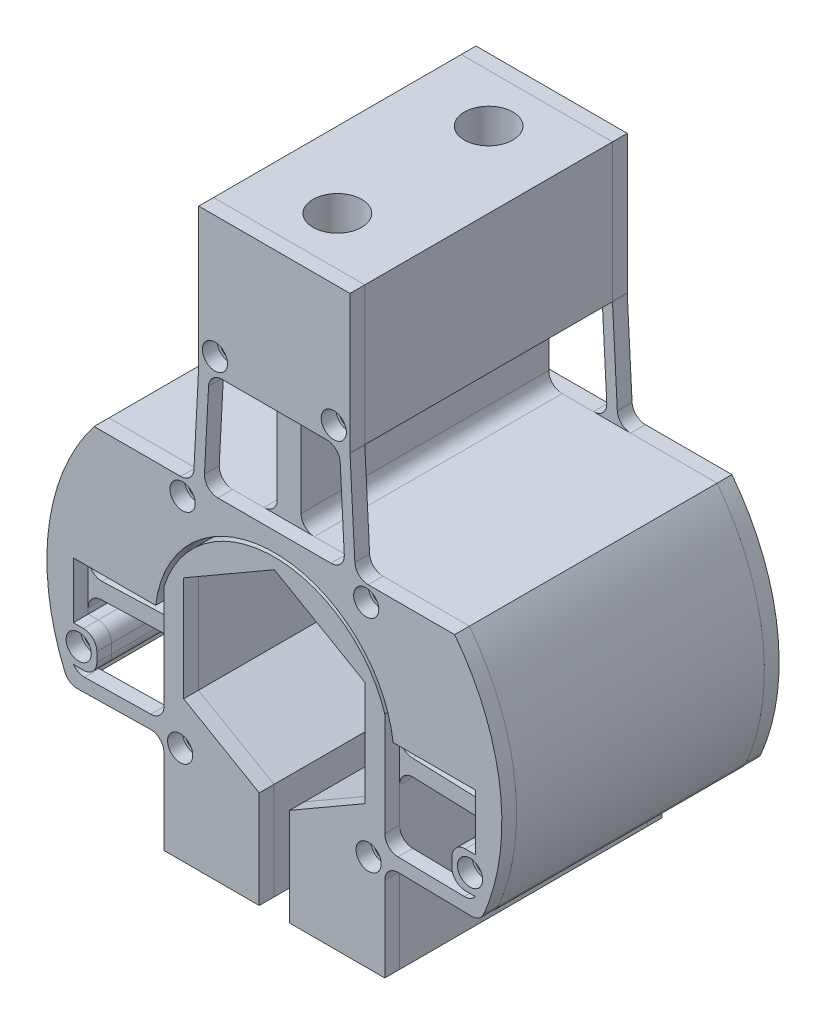
from build123d import *

# Parameters (mm, degrees)
MONKEY_CENTER_W                      = 15.875
MONKEY_CENTER_H                      = 14.525921271
MONKEY_CENTER_W_2                    = 2.5
MONKEY_CENTER_H_2                    = 11
MONKEY_CENTER_W_3                    = 3.8
MONKEY_CENTER_H_3                    = 3.8
CENTRAL_MONKEY_DEPTH                 = 13
CENTRAL_MONKEY_FILLETS_R             = 1.4
MONKEY_FRONT_W                       = 15.875
MONKEY_FRONT_H                       = 14.525921271
MONKEY_FRONT_W_2                     = 3.8
MONKEY_FRONT_H_2                     = 3.8
FRONT_MONKEY_DEPTH                   = 1.55
FRONT_MONKEY_FILLETS_START           = 12
FRONT_MONKEY_FILLETS_DEPTH           = 4
FRONT_MONKEY_FILLETS_START_2         = 13
FRONT_MONKEY_FILLETS_2_DEPTH         = 1.55
TAP_DRILL_FOR_3_48_TAP1_AT_2_COUNT   = 2
TAP_DRILL_FOR_3_48_TAP1_AT_2_PITCH   = 14.795945391
TAP_DRILL_FOR_3_48_TAP1_AT_3_COUNT   = 2
TAP_DRILL_FOR_3_48_TAP1_AT_3_PITCH   = 21.43304983
TAP_DRILL_FOR_3_48_TAP1_AT_4_COUNT   = 2
TAP_DRILL_FOR_3_48_TAP1_AT_4_PITCH   = 19.275
TAP_DRILL_FOR_3_48_TAP1_AT_5_COUNT   = 2
TAP_DRILL_FOR_3_48_TAP1_AT_5_PITCH   = 30.183532001
TAP_DRILL_FOR_3_48_TAP1_AT_6_COUNT   = 2
TAP_DRILL_FOR_3_48_TAP1_AT_6_PITCH   = 23.019176333
TAP_DRILL_FOR_3_48_TAP1_AT_7_COUNT   = 2
TAP_DRILL_FOR_3_48_TAP1_AT_7_PITCH   = 22.007241115
TAP_DRILL_FOR_3_48_TAP1_AT_8_COUNT   = 2
TAP_DRILL_FOR_3_48_TAP1_AT_8_PITCH   = 35.722129408
SKETCH33_W                           = 1.3208
SKETCH33_H                           = 29.1
F_3_CLEARANCE_HOLE1_AT_2_COUNT       = 2
F_3_CLEARANCE_HOLE1_AT_2_PITCH       = 12.475
F_3_CLEARANCE_HOLE1_AT_3_COUNT       = 2
F_3_CLEARANCE_HOLE1_AT_3_PITCH       = 14.795945391
F_3_CLEARANCE_HOLE1_AT_4_COUNT       = 2
F_3_CLEARANCE_HOLE1_AT_4_PITCH       = 21.43304983
F_3_CLEARANCE_HOLE1_AT_5_COUNT       = 2
F_3_CLEARANCE_HOLE1_AT_5_PITCH       = 36.441149158
F_3_CLEARANCE_HOLE1_AT_6_COUNT       = 2
F_3_CLEARANCE_HOLE1_AT_6_PITCH       = 37.595420711
F_3_CLEARANCE_HOLE1_AT_7_COUNT       = 2
F_3_CLEARANCE_HOLE1_AT_7_PITCH       = 40.744432545
F_3_CLEARANCE_HOLE1_AT_8_COUNT       = 2
F_3_CLEARANCE_HOLE1_AT_8_PITCH       = 42.899745894
BOLTS_MIRROR_START                   = -16
BOLTS_MIRROR_OUTLINE_R               = 1.3208
BOLTS_MIRROR_DEPTH                   = 4
SKETCH16_W                           = 1.35255
SKETCH16_H                           = 10
TAP_DRILL_FOR_1_4_20_TAP1_AT_2_COUNT = 2
TAP_DRILL_FOR_1_4_20_TAP1_AT_2_PITCH = 15.875


with BuildPart() as part:
    # monkey-center → central-monkey (new, symmetric)
    with BuildSketch(Plane.XY):
        with Locations((0, 32.820779365)):
            Rectangle(MONKEY_CENTER_W, MONKEY_CENTER_H)
        with Locations((0, 20.057818729)):
            Rectangle(MONKEY_CENTER_W_2, MONKEY_CENTER_H_2)
        with BuildLine():
            Line((21.606429043, -10.16), (21.0875, -10.16))
            Line((21.0875, -10.16), (21.0875, 1.524))
            Line((21.0875, 1.524), (12.46500041, 1.524))
            ThreePointArc((12.46500041, 1.524), (0, 12.557818729), (-12.46500041, 1.524))
            Line((-12.46500041, 1.524), (-21.0875, 1.524))
            Line((-21.0875, 1.524), (-21.0875, -10.16))
            Line((-21.0875, -10.16), (-21.606429043, -10.16))
            ThreePointArc((-21.606429043, -10.16), (-23.736677672, 2.575559953), (-18.924409894, 14.557818729))
            Line((-18.924409894, 14.557818729), (18.924409894, 14.557818729))
            ThreePointArc((18.924409894, 14.557818729), (23.736677672, 2.575559953), (21.606429043, -10.16))
        make_face()
        with BuildLine():
            Line((-1.5875, -10.081979076), (-9.525, -5.499261314))
            Line((-9.525, -5.499261314), (-9.525, 5.499261314))
            Line((-9.525, 5.499261314), (0, 10.998522628))
            Line((0, 10.998522628), (9.525, 5.499261314))
            Line((9.525, 5.499261314), (9.525, -5.499261314))
            Line((9.525, -5.499261314), (1.5875, -10.081979076))
            Line((1.5875, -10.081979076), (1.5875, -20.32))
            Line((1.5875, -20.32), (11.5875, -20.32))
            Line((11.5875, -20.32), (11.5875, -2.077036225))
            Line((11.5875, -2.077036225), (11.5875, -0.376))
            Line((11.5875, -0.376), (11.5875, 3.68))
            ThreePointArc((11.5875, 3.68), (0, 12.157818729), (-11.5875, 3.68))
            Line((-11.5875, 3.68), (-11.5875, -0.376))
            Line((-11.5875, -0.376), (-11.5875, -2.077036225))
            Line((-11.5875, -2.077036225), (-11.5875, -20.32))
            Line((-11.5875, -20.32), (-1.5875, -20.32))
            Line((-1.5875, -20.32), (-1.5875, -10.081979076))
        make_face()
        Polygon((-21.0875, -2.408783535), (-11.5875, -2.077036225), (-11.5875, -0.376), (-21.0875, -0.70774731), align=None)
        Polygon((11.5875, -0.376), (11.5875, -2.077036225), (21.0875, -2.408783535), (21.0875, -0.70774731), align=None)
        with Locations((-20.538310453, -6.26)):
            Rectangle(MONKEY_CENTER_W_3, MONKEY_CENTER_H_3)
        with Locations((20.538310453, -6.26)):
            Rectangle(MONKEY_CENTER_W_3, MONKEY_CENTER_H_3)
    extrude(amount=CENTRAL_MONKEY_DEPTH, both=True)

    # central-monkey-fillets
    # the kernel refuses this fillet: 1.4 mm, written as the material it adds along each edge
    with BuildSketch(Plane(origin=(11.5875, -0.376, -13), x_dir=(0.9993908270190959, -0.034899496702497444, 0), z_dir=(0, 0, 1)), Plane(origin=(-21.0875, -2.408783535, -13), x_dir=(0, -1, 0), z_dir=(0, 0, 1))) as central_monkey_fillets_piece_1:
        with BuildLine():
            CenterArc((CENTRAL_MONKEY_FILLETS_R * 0.965688774807, CENTRAL_MONKEY_FILLETS_R), CENTRAL_MONKEY_FILLETS_R, 182, 88)
            Line((-CENTRAL_MONKEY_FILLETS_R * 0.033702052212, CENTRAL_MONKEY_FILLETS_R * 0.965100503298), (0, 0))
            Line((0, 0), (CENTRAL_MONKEY_FILLETS_R * 0.965688774807, 0))
        make_face()
    extrude(amount=26)
    with BuildSketch(Plane(origin=(21.0875, -0.70774731, -13), x_dir=(0, 1, 0), z_dir=(0, 0, 1)), Plane(origin=(-21.0875, -0.70774731, -13), x_dir=(0.9993908270190959, 0.03489949670249768, 0), z_dir=(0, 0, 1))) as central_monkey_fillets_piece_2:
        with BuildLine():
            CenterArc((CENTRAL_MONKEY_FILLETS_R * 1.03553031379, CENTRAL_MONKEY_FILLETS_R), CENTRAL_MONKEY_FILLETS_R, 178, 92)
            Line((CENTRAL_MONKEY_FILLETS_R * 0.0361394867715, CENTRAL_MONKEY_FILLETS_R * 1.0348994967), (0, 0))
            Line((0, 0), (CENTRAL_MONKEY_FILLETS_R * 1.03553031379, 0))
        make_face()
    extrude(amount=26)
    with BuildSketch(Plane(origin=(-11.5875, -0.376, 13), x_dir=(0, 1, 0), z_dir=(0, 0, -1)), Plane(origin=(21.0875, -2.408783535, 13), x_dir=(-0.9993908270190959, 0.0348994967024972, 0), z_dir=(0, 0, -1))) as central_monkey_fillets_piece_3:
        with BuildLine():
            CenterArc((CENTRAL_MONKEY_FILLETS_R * 0.965688774807, -CENTRAL_MONKEY_FILLETS_R), CENTRAL_MONKEY_FILLETS_R, 90, 88)
            Line((-CENTRAL_MONKEY_FILLETS_R * 0.033702052212, -CENTRAL_MONKEY_FILLETS_R * 0.965100503298), (0, 0))
            Line((0, 0), (CENTRAL_MONKEY_FILLETS_R * 0.965688774807, 0))
        make_face()
    extrude(amount=26)
    with BuildSketch(Plane(origin=(-1.25, 14.557818729, 13), x_dir=(0, 1, 0), z_dir=(0, 0, -1)), Plane(origin=(1.25, 14.557818729, 13), x_dir=(1, 0, 0), z_dir=(0, 0, -1))) as central_monkey_fillets_piece_4:
        with BuildLine():
            CenterArc((CENTRAL_MONKEY_FILLETS_R, -CENTRAL_MONKEY_FILLETS_R), CENTRAL_MONKEY_FILLETS_R, 90, 90)
            Line((0, -CENTRAL_MONKEY_FILLETS_R), (0, 0))
            Line((0, 0), (CENTRAL_MONKEY_FILLETS_R, 0))
        make_face()
    extrude(amount=26)
    with BuildSketch(Plane(origin=(-1.25, 25.557818729, -13), x_dir=(-1, 0, 0), z_dir=(0, 0, 1)), Plane(origin=(1.25, 25.557818729, -13), x_dir=(0, -1, 0), z_dir=(0, 0, 1))) as central_monkey_fillets_piece_5:
        with BuildLine():
            CenterArc((CENTRAL_MONKEY_FILLETS_R, CENTRAL_MONKEY_FILLETS_R), CENTRAL_MONKEY_FILLETS_R, 180, 90)
            Line((0, CENTRAL_MONKEY_FILLETS_R), (0, 0))
            Line((0, 0), (CENTRAL_MONKEY_FILLETS_R, 0))
        make_face()
    extrude(amount=26)
    with BuildSketch(Plane(origin=(11.5875, -2.077036225, 13), x_dir=(0, -1, 0), z_dir=(0, 0, -1)), Plane(origin=(-11.5875, -2.077036225, 13), x_dir=(-0.9993908270190959, -0.03489949670249768, 0), z_dir=(0, 0, -1))) as central_monkey_fillets_piece_6:
        with BuildLine():
            CenterArc((CENTRAL_MONKEY_FILLETS_R * 1.03553031379, -CENTRAL_MONKEY_FILLETS_R), CENTRAL_MONKEY_FILLETS_R, 90, 92)
            Line((CENTRAL_MONKEY_FILLETS_R * 0.0361394867715, -CENTRAL_MONKEY_FILLETS_R * 1.0348994967), (0, 0))
            Line((0, 0), (CENTRAL_MONKEY_FILLETS_R * 1.03553031379, 0))
        make_face()
    extrude(amount=26)
    # the kernel refuses this fillet: 1.4 mm, written as the material it takes off along each edge
    with BuildSketch(Plane(origin=(-18.638310453, -8.16, 16.5), x_dir=(0, 1, 0), z_dir=(0, 0, -1)), Plane(origin=(18.638310453, -4.36, 16.5), x_dir=(0, -1, 0), z_dir=(0, 0, -1))) as central_monkey_fillets_2_piece_1:
        with BuildLine():
            CenterArc((CENTRAL_MONKEY_FILLETS_R, -CENTRAL_MONKEY_FILLETS_R), CENTRAL_MONKEY_FILLETS_R, 90, 90)
            Line((0, -CENTRAL_MONKEY_FILLETS_R), (0, 0))
            Line((0, 0), (CENTRAL_MONKEY_FILLETS_R, 0))
        make_face()
    extrude(amount=33, mode=Mode.SUBTRACT)
    with BuildSketch(Plane(origin=(-18.638310453, -4.36, -16.5), x_dir=(-1, 0, 0), z_dir=(0, 0, 1)), Plane(origin=(18.638310453, -8.16, -16.5), x_dir=(1, 0, 0), z_dir=(0, 0, 1))) as central_monkey_fillets_2_piece_2:
        with BuildLine():
            CenterArc((CENTRAL_MONKEY_FILLETS_R, CENTRAL_MONKEY_FILLETS_R), CENTRAL_MONKEY_FILLETS_R, 180, 90)
            Line((0, CENTRAL_MONKEY_FILLETS_R), (0, 0))
            Line((0, 0), (CENTRAL_MONKEY_FILLETS_R, 0))
        make_face()
    extrude(amount=33, mode=Mode.SUBTRACT)
    with BuildSketch(Plane(origin=(-21.606429043, -10.16, 15.15694949), x_dir=(1, 0, 0), z_dir=(0, 0, -1)), Plane(origin=(21.606429043, -10.16, -15.15694949), x_dir=(-1, 0, 0), z_dir=(0, 0, 1))) as central_monkey_fillets_2_piece_3:
        with BuildLine():
            CenterArc((0.934644279, -1.336854832), CENTRAL_MONKEY_FILLETS_R, 107.273872023, 49.612336383)
            ThreePointArc((-0.352973566, -0.787272912), (-0.180043171, -0.392041951), (0, 0))
            Line((0, 0), (0.518929043, 0))
        make_face()
    extrude(amount=30.313898981, mode=Mode.SUBTRACT)


with BuildPart() as body_2:
    # monkey-front → front-monkey (new body)
    with BuildSketch(Plane.XY.offset(13)):
        with Locations((0, 32.820779365)):
            Rectangle(MONKEY_FRONT_W, MONKEY_FRONT_H)
        Polygon((-7.9375, 25.557818729), (-8.513985572, 14.557818729), (-7.413985572, 14.557818729), (-6.8375, 25.557818729), align=None)
        Polygon((7.413985572, 14.557818729), (8.513985572, 14.557818729), (7.9375, 25.557818729), (6.8375, 25.557818729), align=None)
        with BuildLine():
            Line((21.606429043, -10.16), (21.0875, -10.16))
            Line((21.0875, -10.16), (21.0875, 1.524))
            Line((21.0875, 1.524), (12.46500041, 1.524))
            ThreePointArc((12.46500041, 1.524), (0, 12.557818729), (-12.46500041, 1.524))
            Line((-12.46500041, 1.524), (-21.0875, 1.524))
            Line((-21.0875, 1.524), (-21.0875, -10.16))
            Line((-21.0875, -10.16), (-21.606429043, -10.16))
            ThreePointArc((-21.606429043, -10.16), (-23.736677672, 2.575559953), (-18.924409894, 14.557818729))
            Line((-18.924409894, 14.557818729), (18.924409894, 14.557818729))
            ThreePointArc((18.924409894, 14.557818729), (23.736677672, 2.575559953), (21.606429043, -10.16))
        make_face()
        with BuildLine():
            Line((-1.5875, -10.081979076), (-9.525, -5.499261314))
            Line((-9.525, -5.499261314), (-9.525, 5.499261314))
            Line((-9.525, 5.499261314), (0, 10.998522628))
            Line((0, 10.998522628), (9.525, 5.499261314))
            Line((9.525, 5.499261314), (9.525, -5.499261314))
            Line((9.525, -5.499261314), (1.5875, -10.081979076))
            Line((1.5875, -10.081979076), (1.5875, -20.32))
            Line((1.5875, -20.32), (11.5875, -20.32))
            Line((11.5875, -20.32), (11.5875, -9.994176883))
            Line((11.5875, -9.994176883), (11.5875, -8.594176883))
            Line((11.5875, -8.594176883), (11.5875, 3.68))
            ThreePointArc((11.5875, 3.68), (0, 12.157818729), (-11.5875, 3.68))
            Line((-11.5875, 3.68), (-11.5875, -8.594176883))
            Line((-11.5875, -8.594176883), (-11.5875, -9.994176883))
            Line((-11.5875, -9.994176883), (-11.5875, -20.32))
            Line((-11.5875, -20.32), (-1.5875, -20.32))
            Line((-1.5875, -20.32), (-1.5875, -10.081979076))
        make_face()
        Polygon((-21.0875, -10.16), (-11.5875, -9.994176883), (-11.5875, -8.594176883), (-21.0875, -8.76), align=None)
        Polygon((11.5875, -8.594176883), (11.5875, -9.994176883), (21.0875, -10.16), (21.0875, -8.76), align=None)
        with Locations((-20.538310453, -6.26)):
            Rectangle(MONKEY_FRONT_W_2, MONKEY_FRONT_H_2)
        with Locations((20.538310453, -6.26)):
            Rectangle(MONKEY_FRONT_W_2, MONKEY_FRONT_H_2)
    extrude(amount=FRONT_MONKEY_DEPTH)

    # front-monkey-fillets: read off the stored shape, not the designer's step
    # front-monkey-fillets outline → front-monkey-fillets (cut)
    with BuildSketch(Plane.XY.offset(FRONT_MONKEY_FILLETS_START)):
        with BuildLine():
            Line((18.638310453, -4.36), (18.638310453, -5.76))
            ThreePointArc((18.638310453, -5.76), (19.04836096, -4.770050506), (20.038310453, -4.36))
            Line((20.038310453, -4.36), (18.638310453, -4.36))
        make_face()
        with BuildLine():
            ThreePointArc((20.038310453, -8.16), (19.04836096, -7.749949494), (18.638310453, -6.76))
            Line((18.638310453, -6.76), (18.638310453, -8.16))
            Line((18.638310453, -8.16), (20.038310453, -8.16))
        make_face()
        with BuildLine():
            Line((-18.638310453, -4.36), (-20.038310453, -4.36))
            ThreePointArc((-20.038310453, -4.36), (-19.04836096, -4.770050506), (-18.638310453, -5.76))
            Line((-18.638310453, -5.76), (-18.638310453, -4.36))
        make_face()
        with BuildLine():
            Line((-18.638310453, -8.16), (-18.638310453, -6.76))
            ThreePointArc((-18.638310453, -6.76), (-19.04836096, -7.749949493), (-20.038310453, -8.16))
            Line((-20.038310453, -8.16), (-18.638310453, -8.16))
        make_face()
        with BuildLine():
            ThreePointArc((21.606429043, -10.16), (21.802989861, -9.731033302), (21.991035125, -9.298265973))
            ThreePointArc((21.991035125, -9.298265973), (21.464880219, -9.926654032), (20.677129099, -10.152836949))
            Line((20.677129099, -10.152836949), (21.0875, -10.16))
            Line((21.0875, -10.16), (21.606429043, -10.16))
        make_face()
        with BuildLine():
            ThreePointArc((-20.677129099, -10.152836949), (-21.464880219, -9.926654032), (-21.991035126, -9.298265973))
            ThreePointArc((-21.991035126, -9.298265973), (-21.802989861, -9.731033302), (-21.606429043, -10.16))
            Line((-21.606429043, -10.16), (-21.0875, -10.16))
            Line((-21.0875, -10.16), (-20.677129099, -10.152836949))
        make_face()
    extrude(amount=FRONT_MONKEY_FILLETS_DEPTH, mode=Mode.SUBTRACT)

    # front-monkey-fillets 2 outline → front-monkey-fillets 2 (add)
    with BuildSketch(Plane.XY.offset(FRONT_MONKEY_FILLETS_START_2)):
        with BuildLine():
            Line((11.5875, -8.594176883), (12.963066631, -8.618187488))
            ThreePointArc((12.963066631, -8.618187488), (11.988949371, -8.199673685), (11.5875, -7.218400715))
            Line((11.5875, -7.218400715), (11.5875, -8.594176883))
        make_face()
        with BuildLine():
            Line((21.0875, -8.76), (21.0875, -8.16))
            ThreePointArc((21.0875, -8.16), (20.579057304, -8.592094016), (19.928356233, -8.73976707))
            Line((19.928356233, -8.73976707), (21.0875, -8.76))
        make_face()
        with BuildLine():
            ThreePointArc((-11.5875, -7.218400715), (-11.988949371, -8.199673685), (-12.963066631, -8.618187488))
            Line((-12.963066631, -8.618187488), (-11.5875, -8.594176883))
            Line((-11.5875, -8.594176883), (-11.5875, -7.218400715))
        make_face()
        with BuildLine():
            ThreePointArc((-19.928356233, -8.73976707), (-20.579057304, -8.592094016), (-21.0875, -8.16))
            Line((-21.0875, -8.16), (-21.0875, -8.76))
            Line((-21.0875, -8.76), (-19.928356233, -8.73976707))
        make_face()
        with BuildLine():
            ThreePointArc((11.5875, -11.418827233), (12.00622703, -10.420276605), (13.011933369, -10.01904046))
            Line((13.011933369, -10.01904046), (11.5875, -9.994176883))
            Line((11.5875, -9.994176883), (11.5875, -11.418827233))
        make_face()
        with BuildLine():
            ThreePointArc((9.842535966, 14.557818729), (8.87883956, 14.94229461), (8.444454617, 15.88454839))
            Line((8.444454617, 15.88454839), (8.513985572, 14.557818729))
            Line((8.513985572, 14.557818729), (9.842535966, 14.557818729))
        make_face()
        with BuildLine():
            ThreePointArc((7.939418651, 25.521208681), (7.937979745, 25.557831292), (7.9375, 25.594479019))
            Line((7.9375, 25.594479019), (7.9375, 25.557818729))
            Line((7.9375, 25.557818729), (7.939418651, 25.521208681))
        make_face()
        with BuildLine():
            Line((-11.5875, -9.994176883), (-13.011933369, -10.01904046))
            ThreePointArc((-13.011933369, -10.01904046), (-12.00622703, -10.420276605), (-11.5875, -11.418827233))
            Line((-11.5875, -11.418827233), (-11.5875, -9.994176883))
        make_face()
        with BuildLine():
            Line((-8.513985572, 14.557818729), (-8.444454617, 15.88454839))
            ThreePointArc((-8.444454617, 15.88454839), (-8.87883956, 14.94229461), (-9.842535966, 14.557818729))
            Line((-9.842535966, 14.557818729), (-8.513985572, 14.557818729))
        make_face()
        with BuildLine():
            ThreePointArc((-7.9375, 25.594479019), (-7.937979745, 25.557831292), (-7.939418651, 25.521208681))
            Line((-7.939418651, 25.521208681), (-7.9375, 25.557818729))
            Line((-7.9375, 25.557818729), (-7.9375, 25.594479019))
        make_face()
        with BuildLine():
            ThreePointArc((-6.907030955, 24.231089068), (-6.472646013, 25.173342849), (-5.508949607, 25.557818729))
            Line((-5.508949607, 25.557818729), (-6.8375, 25.557818729))
            Line((-6.8375, 25.557818729), (-6.907030955, 24.231089068))
        make_face()
        with BuildLine():
            Line((6.8375, 25.557818729), (5.508949607, 25.557818729))
            ThreePointArc((5.508949607, 25.557818729), (6.472646013, 25.173342849), (6.907030955, 24.231089068))
            Line((6.907030955, 24.231089068), (6.8375, 25.557818729))
        make_face()
        with BuildLine():
            ThreePointArc((-5.938693397, 14.557818729), (-6.954217516, 14.994122323), (-7.336774745, 16.031089068))
            Line((-7.336774745, 16.031089068), (-7.413985572, 14.557818729))
            Line((-7.413985572, 14.557818729), (-5.938693397, 14.557818729))
        make_face()
        with BuildLine():
            Line((7.413985572, 14.557818729), (7.336774745, 16.031089068))
            ThreePointArc((7.336774745, 16.031089068), (6.954217516, 14.994122323), (5.938693397, 14.557818729))
            Line((5.938693397, 14.557818729), (7.413985572, 14.557818729))
        make_face()
    extrude(amount=FRONT_MONKEY_FILLETS_2_DEPTH)


with BuildPart() as body_3:
    # back-monkey: mirrored copy
    add(body_2.part.mirror(Plane.XY))

    # bolts-mirror: read off the stored shape, not the designer's step
    # bolts-mirror outline → bolts-mirror (cut)
    with BuildSketch(Plane.XY.offset(BOLTS_MIRROR_START)):
        with Locations((-6.2375, 27.257818729)):
            Circle(BOLTS_MIRROR_OUTLINE_R)
        with Locations((20.538310453, -6.26)):
            Circle(BOLTS_MIRROR_OUTLINE_R)
        with Locations((9.8875, -10.16)):
            Circle(BOLTS_MIRROR_OUTLINE_R)
        with Locations((-9.8875, -10.16)):
            Circle(BOLTS_MIRROR_OUTLINE_R)
        with Locations((-20.538310453, -6.26)):
            Circle(BOLTS_MIRROR_OUTLINE_R)
        with Locations((9.6375, 12.857818729)):
            Circle(BOLTS_MIRROR_OUTLINE_R)
        with Locations((-9.6375, 12.857818729)):
            Circle(BOLTS_MIRROR_OUTLINE_R)
        with Locations((6.2375, 27.257818729)):
            Circle(BOLTS_MIRROR_OUTLINE_R)
    extrude(amount=BOLTS_MIRROR_DEPTH, mode=Mode.SUBTRACT)


with BuildPart() as tap_drill_for_3_48_tap1_tool:
    # Sketch26 → Tap Drill for #3-48 Tap1 (revolve)
    with BuildSketch(Plane(origin=(-9.6375, 12.857818729, 14.55), x_dir=(0, -1, 0), z_dir=(1, 0, 0))):
        Polygon((0, 0), (0, 6.999027994), (0.99695, 6.4), (0.99695, 0), align=None)
    tap_drill_for_3_48_tap1 = revolve(axis=Axis((-9.6375, 12.857818729, 20.9), (0, 0, -1)))


with BuildPart() as part_1:
    add(part.part)

    # Tap Drill for #3-48 Tap1: cut by tap_drill_for_3_48_tap1_tool
    add(tap_drill_for_3_48_tap1_tool.part, mode=Mode.SUBTRACT)


with BuildPart() as body_2_1:
    add(body_2.part)

    # Tap Drill for #3-48 Tap1: cut by tap_drill_for_3_48_tap1_tool
    add(tap_drill_for_3_48_tap1_tool.part, mode=Mode.SUBTRACT)


with BuildPart() as tap_drill_for_3_48_tap1_at_2_tool:
    # Tap Drill for #3-48 Tap1 at 2: Tap Drill for #3-48 Tap1 ×2
    with Locations(*[Vector(0.2297926837559568, 0.9732396017899368, 0) * (i * TAP_DRILL_FOR_3_48_TAP1_AT_2_PITCH) for i in range(1, TAP_DRILL_FOR_3_48_TAP1_AT_2_COUNT)]):
        add(tap_drill_for_3_48_tap1)


with BuildPart() as part_2:
    add(part_1.part)

    # Tap Drill for #3-48 Tap1 at 2: cut by tap_drill_for_3_48_tap1_at_2_tool
    add(tap_drill_for_3_48_tap1_at_2_tool.part, mode=Mode.SUBTRACT)


with BuildPart() as body_2_2:
    add(body_2_1.part)

    # Tap Drill for #3-48 Tap1 at 2: cut by tap_drill_for_3_48_tap1_at_2_tool
    add(tap_drill_for_3_48_tap1_at_2_tool.part, mode=Mode.SUBTRACT)


with BuildPart() as tap_drill_for_3_48_tap1_at_3_tool:
    # Tap Drill for #3-48 Tap1 at 3: Tap Drill for #3-48 Tap1 ×2
    with Locations(*[Vector(0.7406785374073724, 0.6718595866876319, 0) * (i * TAP_DRILL_FOR_3_48_TAP1_AT_3_PITCH) for i in range(1, TAP_DRILL_FOR_3_48_TAP1_AT_3_COUNT)]):
        add(tap_drill_for_3_48_tap1)


with BuildPart() as part_3:
    add(part_2.part)

    # Tap Drill for #3-48 Tap1 at 3: cut by tap_drill_for_3_48_tap1_at_3_tool
    add(tap_drill_for_3_48_tap1_at_3_tool.part, mode=Mode.SUBTRACT)


with BuildPart() as body_2_3:
    add(body_2_2.part)

    # Tap Drill for #3-48 Tap1 at 3: cut by tap_drill_for_3_48_tap1_at_3_tool
    add(tap_drill_for_3_48_tap1_at_3_tool.part, mode=Mode.SUBTRACT)


with BuildPart() as tap_drill_for_3_48_tap1_at_4_tool:
    # Tap Drill for #3-48 Tap1 at 4: Tap Drill for #3-48 Tap1 ×2
    with Locations(*[(i * TAP_DRILL_FOR_3_48_TAP1_AT_4_PITCH, 0, 0) for i in range(1, TAP_DRILL_FOR_3_48_TAP1_AT_4_COUNT)]):
        add(tap_drill_for_3_48_tap1)


with BuildPart() as part_4:
    add(part_3.part)

    # Tap Drill for #3-48 Tap1 at 4: cut by tap_drill_for_3_48_tap1_at_4_tool
    add(tap_drill_for_3_48_tap1_at_4_tool.part, mode=Mode.SUBTRACT)


with BuildPart() as body_2_4:
    add(body_2_3.part)

    # Tap Drill for #3-48 Tap1 at 4: cut by tap_drill_for_3_48_tap1_at_4_tool
    add(tap_drill_for_3_48_tap1_at_4_tool.part, mode=Mode.SUBTRACT)


with BuildPart() as tap_drill_for_3_48_tap1_at_5_tool:
    # Tap Drill for #3-48 Tap1 at 5: Tap Drill for #3-48 Tap1 ×2
    with Locations(*[Vector(0.6468759189431474, -0.7625952697804116, 0) * (i * TAP_DRILL_FOR_3_48_TAP1_AT_5_PITCH) for i in range(1, TAP_DRILL_FOR_3_48_TAP1_AT_5_COUNT)]):
        add(tap_drill_for_3_48_tap1)


with BuildPart() as part_5:
    add(part_4.part)

    # Tap Drill for #3-48 Tap1 at 5: cut by tap_drill_for_3_48_tap1_at_5_tool
    add(tap_drill_for_3_48_tap1_at_5_tool.part, mode=Mode.SUBTRACT)


with BuildPart() as body_2_5:
    add(body_2_4.part)

    # Tap Drill for #3-48 Tap1 at 5: cut by tap_drill_for_3_48_tap1_at_5_tool
    add(tap_drill_for_3_48_tap1_at_5_tool.part, mode=Mode.SUBTRACT)


with BuildPart() as tap_drill_for_3_48_tap1_at_6_tool:
    # Tap Drill for #3-48 Tap1 at 6: Tap Drill for #3-48 Tap1 ×2
    with Locations(*[Vector(-0.01086051022783085, -0.9999410229196476, 0) * (i * TAP_DRILL_FOR_3_48_TAP1_AT_6_PITCH) for i in range(1, TAP_DRILL_FOR_3_48_TAP1_AT_6_COUNT)]):
        add(tap_drill_for_3_48_tap1)


with BuildPart() as part_6:
    add(part_5.part)

    # Tap Drill for #3-48 Tap1 at 6: cut by tap_drill_for_3_48_tap1_at_6_tool
    add(tap_drill_for_3_48_tap1_at_6_tool.part, mode=Mode.SUBTRACT)


with BuildPart() as body_2_6:
    add(body_2_5.part)

    # Tap Drill for #3-48 Tap1 at 6: cut by tap_drill_for_3_48_tap1_at_6_tool
    add(tap_drill_for_3_48_tap1_at_6_tool.part, mode=Mode.SUBTRACT)


with BuildPart() as tap_drill_for_3_48_tap1_at_7_tool:
    # Tap Drill for #3-48 Tap1 at 7: Tap Drill for #3-48 Tap1 ×2
    with Locations(*[Vector(-0.4953283510782293, -0.8687058331898794, 0) * (i * TAP_DRILL_FOR_3_48_TAP1_AT_7_PITCH) for i in range(1, TAP_DRILL_FOR_3_48_TAP1_AT_7_COUNT)]):
        add(tap_drill_for_3_48_tap1)


with BuildPart() as part_7:
    add(part_6.part)

    # Tap Drill for #3-48 Tap1 at 7: cut by tap_drill_for_3_48_tap1_at_7_tool
    add(tap_drill_for_3_48_tap1_at_7_tool.part, mode=Mode.SUBTRACT)


with BuildPart() as body_2_7:
    add(body_2_6.part)

    # Tap Drill for #3-48 Tap1 at 7: cut by tap_drill_for_3_48_tap1_at_7_tool
    add(tap_drill_for_3_48_tap1_at_7_tool.part, mode=Mode.SUBTRACT)


with BuildPart() as tap_drill_for_3_48_tap1_at_8_tool:
    # Tap Drill for #3-48 Tap1 at 8: Tap Drill for #3-48 Tap1 ×2
    with Locations(*[Vector(0.8447371686130698, -0.5351813860398867, 0) * (i * TAP_DRILL_FOR_3_48_TAP1_AT_8_PITCH) for i in range(1, TAP_DRILL_FOR_3_48_TAP1_AT_8_COUNT)]):
        add(tap_drill_for_3_48_tap1)


with BuildPart() as part_8:
    add(part_7.part)

    # Tap Drill for #3-48 Tap1 at 8: cut by tap_drill_for_3_48_tap1_at_8_tool
    add(tap_drill_for_3_48_tap1_at_8_tool.part, mode=Mode.SUBTRACT)

    # bolts-mirror 2 outline → bolts-mirror 2 (revolve, cut)
    with BuildSketch(Plane(origin=(20.538310453, -6.26, 0), x_dir=(1, 0, 0), z_dir=(0, -1, 0))):
        Polygon((0.99695, -13), (0.99695, -8.15), (0, -7.550972006), (0, -13), align=None)
    revolve(axis=Axis((20.538310453, -6.26, 0), (0, 0, 1)), mode=Mode.SUBTRACT)

    # bolts-mirror 3 outline → bolts-mirror 3 (revolve, cut)
    with BuildSketch(Plane(origin=(-20.538310453, -6.26, 0), x_dir=(1, 0, 0), z_dir=(0, -1, 0))):
        Polygon((0.99695, -13), (0.99695, -8.15), (0, -7.550972006), (0, -13), align=None)
    revolve(axis=Axis((-20.538310453, -6.26, 0), (0, 0, 1)), mode=Mode.SUBTRACT)

    # bolts-mirror 4 outline → bolts-mirror 4 (revolve, cut)
    with BuildSketch(Plane(origin=(-9.8875, -10.16, 0), x_dir=(1, 0, 0), z_dir=(0, -1, 0))):
        Polygon((0.99695, -13), (0.99695, -8.15), (0, -7.550972006), (0, -13), align=None)
    revolve(axis=Axis((-9.8875, -10.16, 0), (0, 0, 1)), mode=Mode.SUBTRACT)

    # bolts-mirror 5 outline → bolts-mirror 5 (revolve, cut)
    with BuildSketch(Plane(origin=(9.8875, -10.16, 0), x_dir=(1, 0, 0), z_dir=(0, -1, 0))):
        Polygon((0.99695, -13), (0.99695, -8.15), (0, -7.550972006), (0, -13), align=None)
    revolve(axis=Axis((9.8875, -10.16, 0), (0, 0, 1)), mode=Mode.SUBTRACT)

    # bolts-mirror 6 outline → bolts-mirror 6 (revolve, cut)
    with BuildSketch(Plane(origin=(9.6375, 12.857818729, 0), x_dir=(1, 0, 0), z_dir=(0, -1, 0))):
        Polygon((0.99695, -13), (0.99695, -8.15), (0, -7.550972006), (0, -13), align=None)
    revolve(axis=Axis((9.6375, 12.857818729, 0), (0, 0, 1)), mode=Mode.SUBTRACT)

    # bolts-mirror 7 outline → bolts-mirror 7 (revolve, cut)
    with BuildSketch(Plane(origin=(6.2375, 27.257818729, 0), x_dir=(1, 0, 0), z_dir=(0, -1, 0))):
        Polygon((0.99695, -13), (0.99695, -8.15), (0, -7.550972006), (0, -13), align=None)
    revolve(axis=Axis((6.2375, 27.257818729, 0), (0, 0, 1)), mode=Mode.SUBTRACT)

    # bolts-mirror 8 outline → bolts-mirror 8 (revolve, cut)
    with BuildSketch(Plane(origin=(-6.2375, 27.257818729, 0), x_dir=(1, 0, 0), z_dir=(0, -1, 0))):
        Polygon((0.99695, -13), (0.99695, -8.15), (0, -7.550972006), (0, -13), align=None)
    revolve(axis=Axis((-6.2375, 27.257818729, 0), (0, 0, 1)), mode=Mode.SUBTRACT)

    # bolts-mirror 9 outline → bolts-mirror 9 (revolve, cut)
    with BuildSketch(Plane(origin=(-9.6375, 12.857818729, 0), x_dir=(1, 0, 0), z_dir=(0, -1, 0))):
        Polygon((0.99695, -13), (0.99695, -8.15), (0, -7.550972006), (0, -13), align=None)
    revolve(axis=Axis((-9.6375, 12.857818729, 0), (0, 0, 1)), mode=Mode.SUBTRACT)

    # Sketch13 → CBORE for #6 Socket Head Cap Screw1 (revolve, cut)
    with BuildSketch(Plane(origin=(11.5875, -15.24, 0), x_dir=(0, 0, -1), z_dir=(0, 1, 0))):
        Polygon((0, 0), (0, 10), (1.89865, 10), (1.89865, 3.5052), (3.57251, 3.5052), (3.57251, 0), align=None)
    revolve(axis=Axis((17.9375, -15.24, 0), (-1, 0, 0)), mode=Mode.SUBTRACT)

    # Sketch16 → Tap Drill for #6-32 Tap1 (revolve, cut)
    with BuildSketch(Plane(origin=(-11.5875, -15.24, 0), x_dir=(0, 0, 1), z_dir=(0, 1, 0))):
        with Locations((0.676275, 5)):
            Rectangle(SKETCH16_W, SKETCH16_H)
    revolve(axis=Axis((-17.9375, -15.24, 0), (1, 0, 0)), mode=Mode.SUBTRACT)

    # Sketch19 → Tap Drill for 1/4-20 Tap1 (revolve, cut)
    with BuildSketch(Plane(origin=(0, 40.08374, 7.9375), x_dir=(0, 0, 1), z_dir=(1, 0, 0))):
        Polygon((0, 0), (0, 11.693816902), (2.5527, 10.16), (2.5527, 0), align=None)
    tap_drill_for_1_4_20_tap1 = revolve(axis=Axis((0, 46.43374, 7.9375), (0, -1, 0)), mode=Mode.SUBTRACT)

    # Tap Drill for 1/4-20 Tap1 at 2: Tap Drill for 1/4-20 Tap1 ×2
    with Locations(*[(0, 0, -i * TAP_DRILL_FOR_1_4_20_TAP1_AT_2_PITCH) for i in range(1, TAP_DRILL_FOR_1_4_20_TAP1_AT_2_COUNT)]):
        add(tap_drill_for_1_4_20_tap1, mode=Mode.SUBTRACT)


with BuildPart() as body_2_8:
    add(body_2_7.part)

    # Tap Drill for #3-48 Tap1 at 8: cut by tap_drill_for_3_48_tap1_at_8_tool
    add(tap_drill_for_3_48_tap1_at_8_tool.part, mode=Mode.SUBTRACT)

    # Sketch33 → #3 Clearance Hole1 (revolve, cut)
    with BuildSketch(Plane(origin=(-6.2375, 27.257818729, 14.55), x_dir=(0, -1, 0), z_dir=(1, 0, 0))):
        with Locations((0.6604, 14.55)):
            Rectangle(SKETCH33_W, SKETCH33_H)
    f_3_clearance_hole1 = revolve(axis=Axis((-6.2375, 27.257818729, 20.9), (0, 0, -1)), mode=Mode.SUBTRACT)

    # #3 Clearance Hole1 at 2: #3 Clearance Hole1 ×2
    with Locations(*[(i * F_3_CLEARANCE_HOLE1_AT_2_PITCH, 0, 0) for i in range(1, F_3_CLEARANCE_HOLE1_AT_2_COUNT)]):
        add(f_3_clearance_hole1, mode=Mode.SUBTRACT)

    # #3 Clearance Hole1 at 3: #3 Clearance Hole1 ×2
    with Locations(*[Vector(-0.2297926837559568, -0.9732396017899368, 0) * (i * F_3_CLEARANCE_HOLE1_AT_3_PITCH) for i in range(1, F_3_CLEARANCE_HOLE1_AT_3_COUNT)]):
        add(f_3_clearance_hole1, mode=Mode.SUBTRACT)

    # #3 Clearance Hole1 at 4: #3 Clearance Hole1 ×2
    with Locations(*[Vector(0.7406785374073724, -0.6718595866876319, 0) * (i * F_3_CLEARANCE_HOLE1_AT_4_PITCH) for i in range(1, F_3_CLEARANCE_HOLE1_AT_4_COUNT)]):
        add(f_3_clearance_hole1, mode=Mode.SUBTRACT)

    # #3 Clearance Hole1 at 5: #3 Clearance Hole1 ×2
    with Locations(*[Vector(-0.3924357706502156, -0.9197794115515803, 0) * (i * F_3_CLEARANCE_HOLE1_AT_5_PITCH) for i in range(1, F_3_CLEARANCE_HOLE1_AT_5_COUNT)]):
        add(f_3_clearance_hole1, mode=Mode.SUBTRACT)

    # #3 Clearance Hole1 at 6: #3 Clearance Hole1 ×2
    with Locations(*[Vector(-0.09708629218563344, -0.9952759676942098, 0) * (i * F_3_CLEARANCE_HOLE1_AT_6_PITCH) for i in range(1, F_3_CLEARANCE_HOLE1_AT_6_COUNT)]):
        add(f_3_clearance_hole1, mode=Mode.SUBTRACT)

    # #3 Clearance Hole1 at 7: #3 Clearance Hole1 ×2
    with Locations(*[Vector(0.3957595919894397, -0.9183541502864525, 0) * (i * F_3_CLEARANCE_HOLE1_AT_7_PITCH) for i in range(1, F_3_CLEARANCE_HOLE1_AT_7_COUNT)]):
        add(f_3_clearance_hole1, mode=Mode.SUBTRACT)

    # #3 Clearance Hole1 at 8: #3 Clearance Hole1 ×2
    with Locations(*[Vector(0.6241484627750318, -0.7813057637158227, 0) * (i * F_3_CLEARANCE_HOLE1_AT_8_PITCH) for i in range(1, F_3_CLEARANCE_HOLE1_AT_8_COUNT)]):
        add(f_3_clearance_hole1, mode=Mode.SUBTRACT)


solid = Compound([body_3.part, part_8.part, body_2_8.part])
